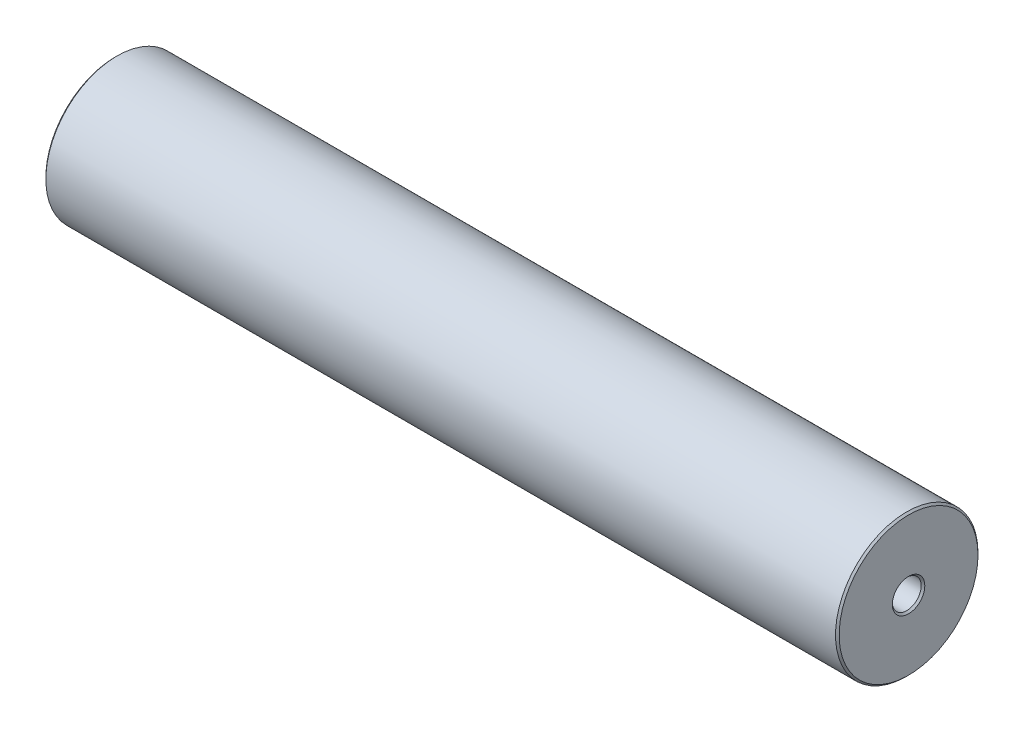
from build123d import *

# Parameters (mm, degrees)
SKETCH2_R                            = 9.980949939
BOSS_EXTRUDE1_DEPTH                  = 55.5625
F_10_32_TAPPED_HOLE1_D               = 4.0386
F_10_32_TAPPED_HOLE1_DEPTH           = 11.938
F_10_32_TAPPED_HOLE1_TIP             = 1.213317848
F_10_32_TAPPED_HOLE1_ON_FACE_2_D     = 4.0386
F_10_32_TAPPED_HOLE1_ON_FACE_2_DEPTH = 11.938
F_10_32_TAPPED_HOLE1_ON_FACE_2_TIP   = 1.213317848
CHAMFER1_SIZE                        = 0.254


with BuildPart() as part:
    # Sketch2 → Boss-Extrude1 (new, symmetric)
    with BuildSketch(Plane(origin=(0, 0, 0), x_dir=(0, 0, -1), z_dir=(1, 0, 0))):
        Circle(SKETCH2_R)
    extrude(amount=BOSS_EXTRUDE1_DEPTH, both=True)

    # #10-32 Tapped Hole1
    with Locations(Plane(origin=(55.5625, 0, 0), x_dir=(0, 0, 1), z_dir=(1, 0, 0))):
        with Locations((0, 0)):
            Hole(F_10_32_TAPPED_HOLE1_D / 2, depth=F_10_32_TAPPED_HOLE1_DEPTH)
            with Locations((0, 0, -(F_10_32_TAPPED_HOLE1_DEPTH + F_10_32_TAPPED_HOLE1_TIP / 2))):  # 118° drill point
                Cone(0, F_10_32_TAPPED_HOLE1_D / 2, F_10_32_TAPPED_HOLE1_TIP, mode=Mode.SUBTRACT)

    # #10-32 Tapped Hole1 on face 2
    with Locations(Plane(origin=(-55.5625, 0, 0), x_dir=(0, 0, -1), z_dir=(-1, 0, 0))):
        with Locations((0, 0)):
            Hole(F_10_32_TAPPED_HOLE1_ON_FACE_2_D / 2, depth=F_10_32_TAPPED_HOLE1_ON_FACE_2_DEPTH)
            with Locations((0, 0, -(F_10_32_TAPPED_HOLE1_ON_FACE_2_DEPTH + F_10_32_TAPPED_HOLE1_ON_FACE_2_TIP / 2))):  # 118° drill point
                Cone(0, F_10_32_TAPPED_HOLE1_ON_FACE_2_D / 2, F_10_32_TAPPED_HOLE1_ON_FACE_2_TIP, mode=Mode.SUBTRACT)

    # Chamfer1
    chamfer1_edges = [part.edges().sort_by_distance(p)[0] for p in [
        (55.5625, 0, 9.980949939),
        (55.5625, 0, 2.0193),
        (-55.5625, 0, 9.980949939),
        (-55.5625, 0, -2.0193),
    ]]
    chamfer(chamfer1_edges, length=CHAMFER1_SIZE)


solid = part.part
